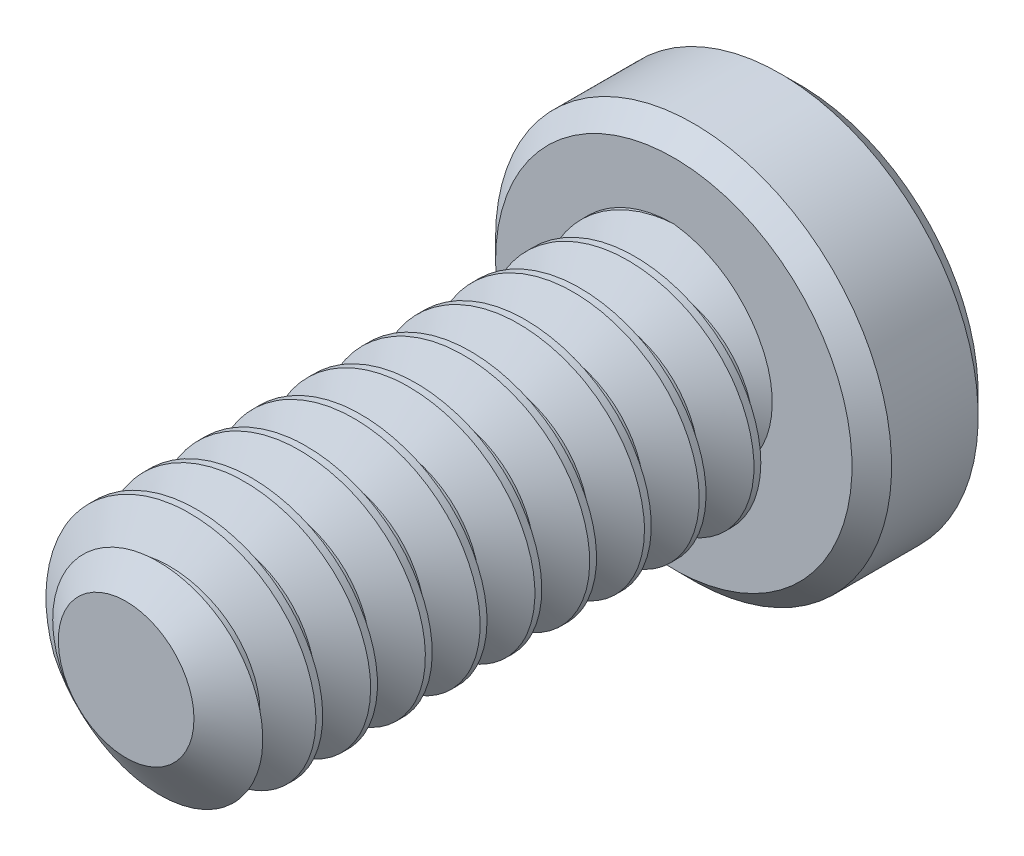
from build123d import *

# Parameters (mm, degrees)
SKETCH1_R          = 1.7526
EXTRUDE1_DEPTH     = 7.9375
CUT_SWEEP1_PITCH   = 0.79375
SKETCH6_R          = 2.8702
EXTRUDE2_DEPTH     = 1.8288
CUT_EXTRUDE1_DEPTH = 1.190625
CHAMFER1_SIZE      = 0.28702


with BuildPart() as part:
    # Sketch1 → Extrude1 (new body)
    with BuildSketch(Plane.XY):
        Circle(SKETCH1_R)
    extrude(amount=-EXTRUDE1_DEPTH)

    # Cut-Sweep1: the profile of Sketch3 profile screwed along a right-hand helix of 11 turns, 6 arcs to a turn; built about Z, then put on its axis
    cut_sweep1_z = Axis((0, 0, 0), (0, 0, 1))
    cut_sweep1_corners = [(1.7529, 0, -0.694704455), (1.237044252, 0, -0.396875), (1.237044252, 0, -0.29765625), (1.7529, 0, 0.000173205)]
    with BuildLine(mode=Mode.PRIVATE) as cut_sweep1_profile:
        Line(cut_sweep1_corners[0], cut_sweep1_corners[1])
        Line(cut_sweep1_corners[1], cut_sweep1_corners[2])
        Line(cut_sweep1_corners[2], cut_sweep1_corners[3])
        Line(cut_sweep1_corners[3], cut_sweep1_corners[0])
    cut_sweep1_cap = Face(cut_sweep1_profile.wire())
    cut_sweep1_turn_angles = [0, 30, 60, 90, 120, 150, 180, 210, 240, 270, 300, 330, 360]
    cut_sweep1_turn_weights = [1, 0.8660254037844387, 1, 0.8660254037844387, 1, 0.8660254037844387, 1, 0.8660254037844387, 1, 0.8660254037844387, 1, 0.8660254037844387, 1]
    cut_sweep1_turn_rails = [Edge.make_bspline([Vector(p[0], p[1], 0).rotate(cut_sweep1_z, cut_sweep1_turn_angles[k]) / cut_sweep1_turn_weights[k] + Vector(0, 0, p[2] + CUT_SWEEP1_PITCH * cut_sweep1_turn_angles[k] / 360) for k in range(13)], [0, 0, 0, 1, 1, 2, 2, 3, 3, 4, 4, 5, 5, 6, 6, 6], 2, cut_sweep1_turn_weights) for p in cut_sweep1_corners]
    cut_sweep1_turn_sides = [Face.make_surface_from_curves(cut_sweep1_turn_rails[p[0]], cut_sweep1_turn_rails[p[1]]) for p in [(0, 1), (1, 2), (2, 3), (3, 0)]]
    cut_sweep1 = Plane(origin=(0, 0, 0), x_dir=(0, 1, 0), z_dir=(0, 0, -1)) * Solid(Shell([*[p.moved(Location((0, 0, CUT_SWEEP1_PITCH * i))) for i in range(11) for p in cut_sweep1_turn_sides], cut_sweep1_cap, cut_sweep1_cap.rotate(cut_sweep1_z, 3960).moved(Location((0, 0, CUT_SWEEP1_PITCH * 3960 / 360)))]))
    add(cut_sweep1, mode=Mode.SUBTRACT)

    # Sketch4 → Cut-Revolve1 (revolve, cut)
    with BuildSketch(Plane(origin=(0, 0, 0), x_dir=(0, 0, -1), z_dir=(1, 0, 0)), mode=Mode.PRIVATE) as cut_revolve1_sk:
        Polygon((0.538848736, 1.7526), (0, 0.983044252), (0, 1.7526), align=None)
    revolve(cut_revolve1_sk.sketch.rotate(Axis((0, 0, 0), (0, 0, -1)), 261.048315518), axis=Axis((0, 0, 0), (0, 0, -1)), mode=Mode.SUBTRACT)

    # Sketch6 → Extrude2 (add)
    with BuildSketch(Plane(origin=(0, 0, -7.9375), x_dir=(-1, 0, 0), z_dir=(0, 0, -1))):
        Circle(SKETCH6_R)
    extrude(amount=EXTRUDE2_DEPTH)

    # Sketch7 → Cut-Extrude1 (cut)
    with BuildSketch(Plane(origin=(0, 0, -9.7663), x_dir=(-1, 0, 0), z_dir=(0, 0, -1))):
        Polygon((0, 0.916543552), (-0.79375, 0.458271776), (-0.79375, -0.458271776), (0, -0.916543552), (0.79375, -0.458271776), (0.79375, 0.458271776), align=None)
    extrude(amount=-CUT_EXTRUDE1_DEPTH, mode=Mode.SUBTRACT)

    # Cut-Extrude2 cone 1 section (through the dimple's axis) → Cut-Extrude2 (revolve, cut)
    with BuildSketch(Plane(origin=(0, 0, -9.7663), x_dir=(0, 1, 0), z_dir=(1, 0, 0))):
        Polygon((0, 0), (0.916543552, 0), (0, 0.916543552), align=None)
    revolve(axis=Axis((0, 0, -9.7663), (0, 0, 1)), mode=Mode.SUBTRACT)

    # Chamfer1
    chamfer1_edges = [part.edges().sort_by_distance(p)[0] for p in [
        (2.8702, 0, -7.9375),
        (2.8702, 0, -9.7663),
    ]]
    chamfer(chamfer1_edges, length=CHAMFER1_SIZE)


solid = part.part
